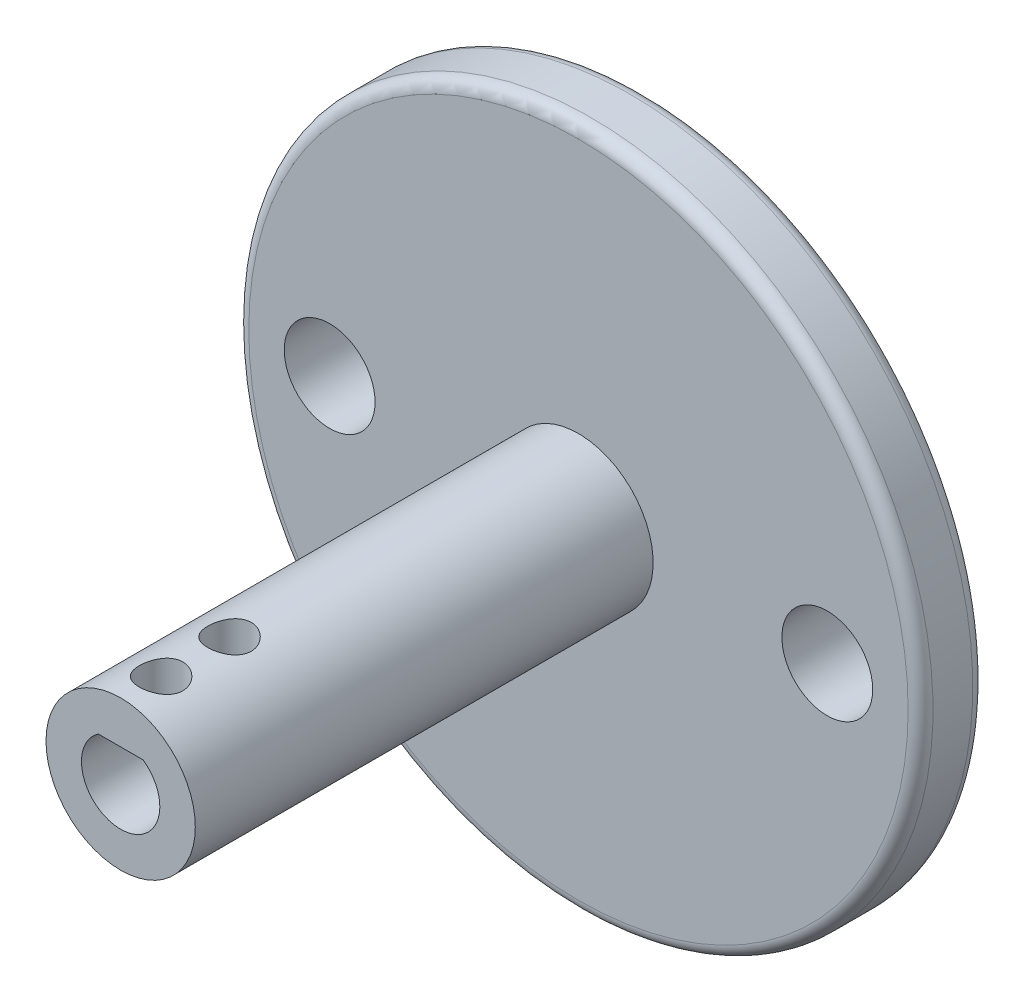
from build123d import *

# Parameters (mm, degrees)
CROQUIS1_R                   = 6
SALIENTE_EXTRUIR1_DEPTH      = 40
CROQUIS2_R                   = 1.75
CORTAR_EXTRUIR1_DEPTH        = 7.5
SALIENTE_EXTRUIR2_DEPTH      = 2
SALIENTE_EXTRUIR2_DEPTH_BACK = 3.2
CROQUIS3_R                   = 27.5
CORTAR_EXTRUIR2_DEPTH        = 58.240719845
CORTAR_EXTRUIR2_DEPTH_BACK   = 5.2
CROQUIS5_R                   = 3.65
REDONDEO1_R                  = 1


with BuildPart() as part:
    # Croquis1 → Saliente-Extruir1 (new body)
    with BuildSketch(Plane.XY):
        Circle(CROQUIS1_R)
        with BuildLine():
            Line((-1.8, 2.585053191), (1.8, 2.585053191))
            ThreePointArc((1.8, 2.585053191), (0, -3.15), (-1.8, 2.585053191))
        make_face(mode=Mode.SUBTRACT)
    extrude(amount=SALIENTE_EXTRUIR1_DEPTH)

    # Croquis2 → Cortar-Extruir1 (cut)
    with BuildSketch(Plane(origin=(0, 2.585053191, 0), x_dir=(1, 0, 0), z_dir=(0, 1, 0))):
        with Locations((0, -36.75)):
            Circle(CROQUIS2_R)
        with Locations((0, -31.25)):
            Circle(CROQUIS2_R)
    extrude(amount=CORTAR_EXTRUIR1_DEPTH, mode=Mode.SUBTRACT)

    # Croquis3 → Saliente-Extruir2 (add, two sides: drawn at the far end of the back side and taken through both)
    with BuildSketch(Plane(origin=(0, 0, 0), x_dir=(-1, 0, 0), z_dir=(0, 0, -1)).offset(-SALIENTE_EXTRUIR2_DEPTH_BACK)):
        Circle(CROQUIS3_R)
    extrude(amount=SALIENTE_EXTRUIR2_DEPTH + SALIENTE_EXTRUIR2_DEPTH_BACK)

    # Croquis5 → Cortar-Extruir2 (cut, two sides: drawn at the far end of the back side and taken through both)
    with BuildSketch(Plane(origin=(0, 0, -2), x_dir=(-1, 0, 0), z_dir=(0, 0, -1)).offset(-CORTAR_EXTRUIR2_DEPTH_BACK)):
        with Locations((-20, 0)):
            Circle(CROQUIS5_R)
        with Locations((20, 0)):
            Circle(CROQUIS5_R)
    extrude(amount=CORTAR_EXTRUIR2_DEPTH + CORTAR_EXTRUIR2_DEPTH_BACK, mode=Mode.SUBTRACT)

    # Redondeo1
    redondeo1_edges = [part.edges().sort_by_distance(p)[0] for p in [
        (27.5, 0, -2),
        (27.5, 0, 3.2),
    ]]
    fillet(redondeo1_edges, radius=REDONDEO1_R)


solid = part.part
